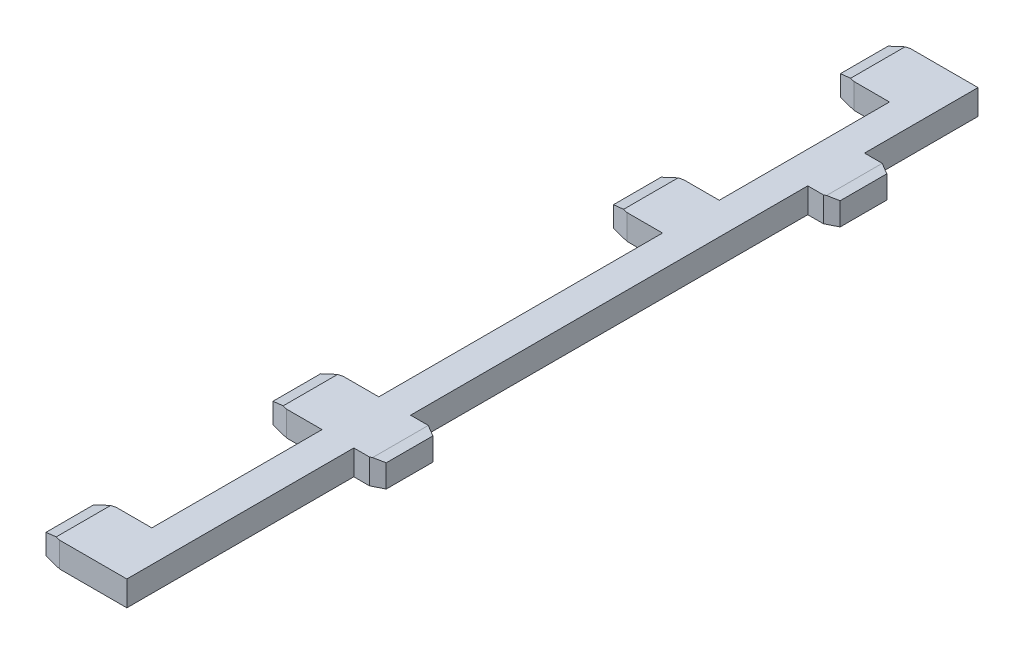
from build123d import *

# Parameters (mm, degrees)
SKETCH1_W               = 3.556
SKETCH1_H               = 95.25
BOSS_EXTRUDE1_DEPTH     = 1.399999994
BOSS_EXTRUDE2_START     = -2.799999988
BOSS_EXTRUDE2_DEPTH     = 2.799999988
CUT_EXTRUDE1_DEPTH      = 96.57729743
CUT_EXTRUDE1_DEPTH_BACK = 96.57729743


# Read off the part's stored shape, not the designer's step: Boss-Extrude2
with BuildPart() as part:
    # Sketch1 → Boss-Extrude1 (new, symmetric)
    with BuildSketch(Plane(origin=(0, 0, 0), x_dir=(1, 0, 0), z_dir=(0, 1, 0))):
        Rectangle(SKETCH1_W, SKETCH1_H)
    extrude(amount=BOSS_EXTRUDE1_DEPTH, both=True)

    # Boss-Extrude2 outline → Boss-Extrude2 (add)
    with BuildSketch(Plane(origin=(0, 1.399999994, 0), x_dir=(1, 0, 0), z_dir=(0, 1, 0)).offset(BOSS_EXTRUDE2_START)):
        Polygon((-1.778, 47.625), (-5.746, 47.625), (-7.778, 47.117), (-7.778, 41.783), (-5.746, 41.275), (-1.778, 41.275), align=None)
        Polygon((3.762000096, 34.925), (1.778, 34.925), (1.778, 28.575), (3.526821698, 28.575), (4.778000096, 29.200589199), (4.778000096, 34.417), align=None)
        Polygon((-1.778, 15.875), (-1.778, 22.225), (-5.746, 22.225), (-7.778, 21.717), (-7.778, 16.383), (-5.746, 15.875), align=None)
        Polygon((3.762000096, -15.875), (1.778, -15.875), (1.778, -22.225), (3.526821698, -22.225), (4.778000096, -21.599410801), (4.778000096, -16.383), align=None)
        Polygon((-1.778, -22.225), (-1.778, -15.875), (-5.746, -15.875), (-7.778, -16.383), (-7.778, -21.717), (-5.746, -22.225), align=None)
        Polygon((-1.778, -47.625), (-1.778, -41.275), (-5.746, -41.275), (-7.778, -41.783), (-7.778, -47.117), (-5.746, -47.625), align=None)
    extrude(amount=BOSS_EXTRUDE2_DEPTH)

    # Sketch3 → Cut-Extrude1 (cut, two sides: drawn at the far end of the back side and taken through both)
    with BuildSketch(Plane.XY.offset(47.625).offset(-CUT_EXTRUDE1_DEPTH_BACK)):
        Polygon((-7.778, 0.891999994), (-6.254, 1.399999994), (-7.778, 1.399999994), align=None)
        Polygon((4.778000096, 1.145999994), (4.778000096, 1.399999994), (3.762000096, 1.399999994), align=None)
    extrude(amount=CUT_EXTRUDE1_DEPTH + CUT_EXTRUDE1_DEPTH_BACK, mode=Mode.SUBTRACT)


solid = part.part
